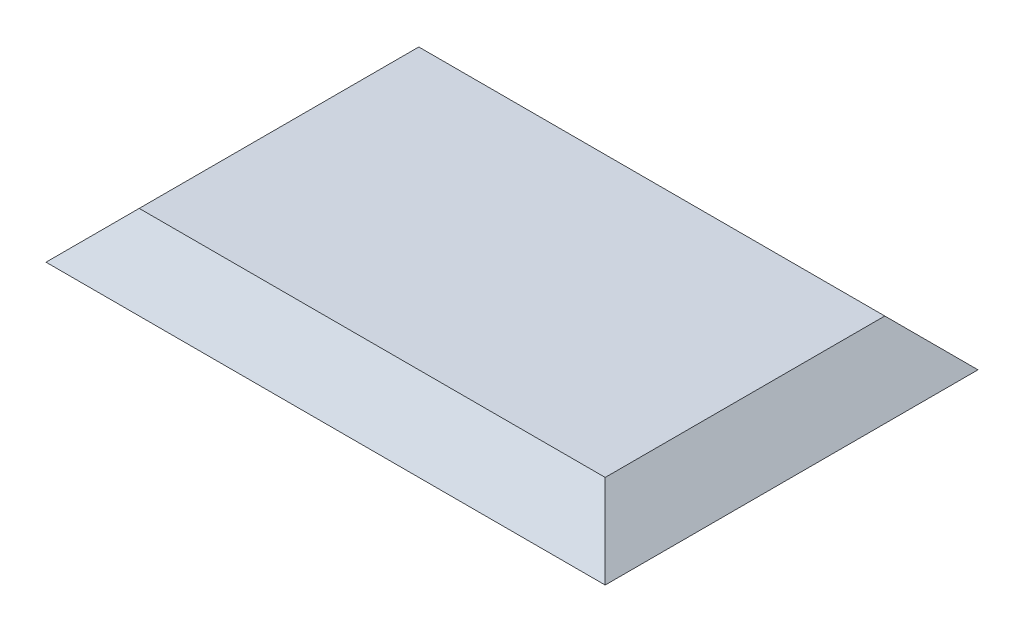
from build123d import *

# Parameters (mm, degrees)
ESQUISSE1_W        = 3.6
ESQUISSE1_H        = 2.4
BOSS_EXTRU_1_DEPTH = 0.6
CHANFREIN1_SIZE    = 0.3


with BuildPart() as part:
    # Esquisse1 → Boss.-Extru.1 (new body)
    with BuildSketch(Plane(origin=(0, 0, 0), x_dir=(1, 0, 0), z_dir=(0, 1, 0))):
        Rectangle(ESQUISSE1_W, ESQUISSE1_H)
    extrude(amount=BOSS_EXTRU_1_DEPTH)

    # Chanfrein1
    # the kernel refuses this chamfer: 0.3 mm, written as the material it takes off along each edge
    with BuildSketch(Plane(origin=(2.571504896, 0, 1.2), x_dir=(0, 0.9996219169112968, 0.027495876610586632), z_dir=(-1, 0, 0)), Plane(origin=(-2.571504896, 0, -1.2), x_dir=(0, 0.9996219169112968, -0.027495876610586632), z_dir=(1, 0, 0))) as chanfrein1_piece_1:
        Polygon((CHANFREIN1_SIZE * 0.999621916911, CHANFREIN1_SIZE * 0.0274958766106), (-CHANFREIN1_SIZE * 0.0274958766106, CHANFREIN1_SIZE * 0.999621916911), (0, 0), align=None)
    extrude(amount=5.143009793, mode=Mode.SUBTRACT)
    with BuildSketch(Plane(origin=(1.8, 0, -1.971504896), x_dir=(0.027495876610586632, 0.9996219169112968, 0), z_dir=(0, 0, 1)), Plane(origin=(-1.8, 0, 1.971504896), x_dir=(-0.027495876610586632, 0.9996219169112968, 0), z_dir=(0, 0, -1))) as chanfrein1_piece_2:
        Polygon((CHANFREIN1_SIZE * 0.999621916911, CHANFREIN1_SIZE * 0.0274958766106), (-CHANFREIN1_SIZE * 0.0274958766106, CHANFREIN1_SIZE * 0.999621916911), (0, 0), align=None)
    extrude(amount=3.943009793, mode=Mode.SUBTRACT)
    with BuildSketch(Plane(origin=(-2.571504896, 0.6, -1.2), x_dir=(0, -0.9996219169112968, -0.027495876610586632), z_dir=(1, 0, 0)), Plane(origin=(2.571504896, 0.6, 1.2), x_dir=(0, -0.9996219169112968, 0.027495876610586632), z_dir=(-1, 0, 0))) as chanfrein1_piece_3:
        Polygon((CHANFREIN1_SIZE * 0.999621916911, -CHANFREIN1_SIZE * 0.0274958766106), (-CHANFREIN1_SIZE * 0.0274958766106, -CHANFREIN1_SIZE * 0.999621916911), (0, 0), align=None)
    extrude(amount=5.143009793, mode=Mode.SUBTRACT)
    with BuildSketch(Plane(origin=(1.8, 0.6, -1.971504896), x_dir=(0.027495876610586632, -0.9996219169112968, 0), z_dir=(0, 0, 1)), Plane(origin=(-1.8, 0.6, 1.971504896), x_dir=(-0.027495876610586632, -0.9996219169112968, 0), z_dir=(0, 0, -1))) as chanfrein1_piece_4:
        Polygon((CHANFREIN1_SIZE * 0.999621916911, -CHANFREIN1_SIZE * 0.0274958766106), (-CHANFREIN1_SIZE * 0.0274958766106, -CHANFREIN1_SIZE * 0.999621916911), (0, 0), align=None)
    extrude(amount=3.943009793, mode=Mode.SUBTRACT)


solid = part.part
